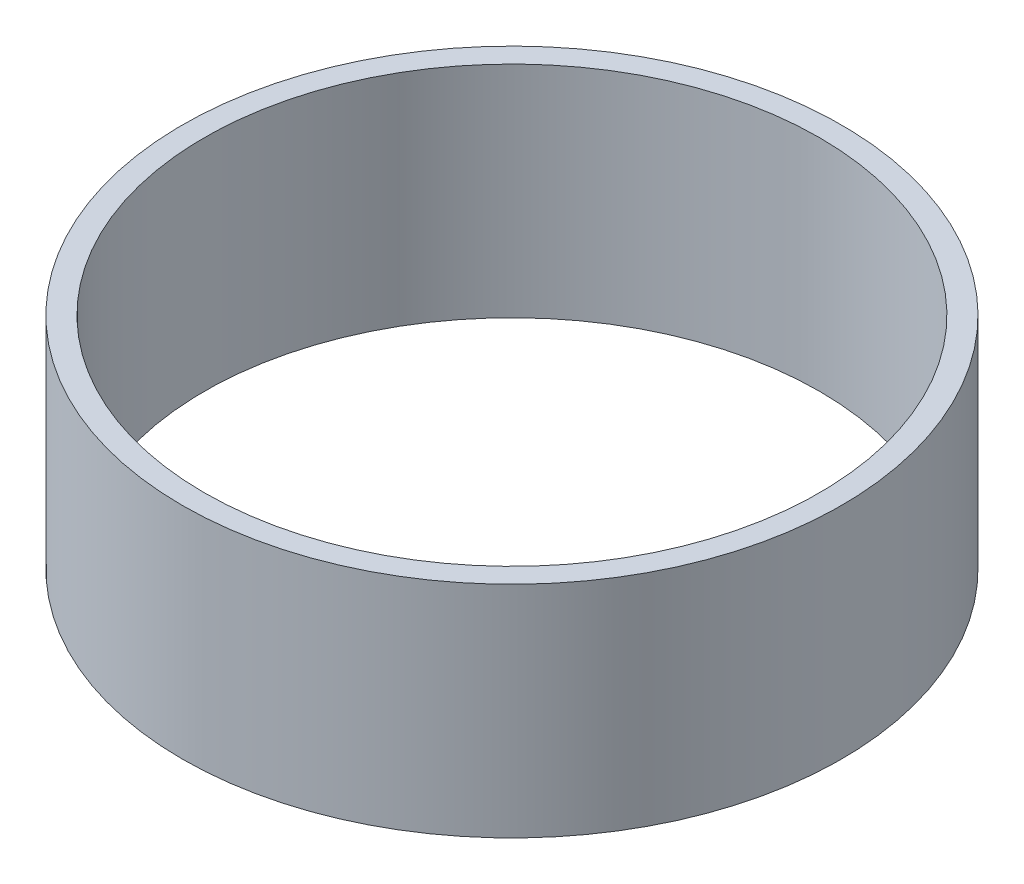
from build123d import *

# Parameters (mm, degrees)
SKETCH1_R           = 37.5
SKETCH1_R_2         = 35
BOSS_EXTRUDE1_DEPTH = 25


with BuildPart() as part:
    # Sketch1 → Boss-Extrude1 (new body)
    with BuildSketch(Plane(origin=(0, 0, 0), x_dir=(1, 0, 0), z_dir=(0, 1, 0))):
        Circle(SKETCH1_R)
        Circle(SKETCH1_R_2, mode=Mode.SUBTRACT)
    extrude(amount=BOSS_EXTRUDE1_DEPTH)


solid = part.part
